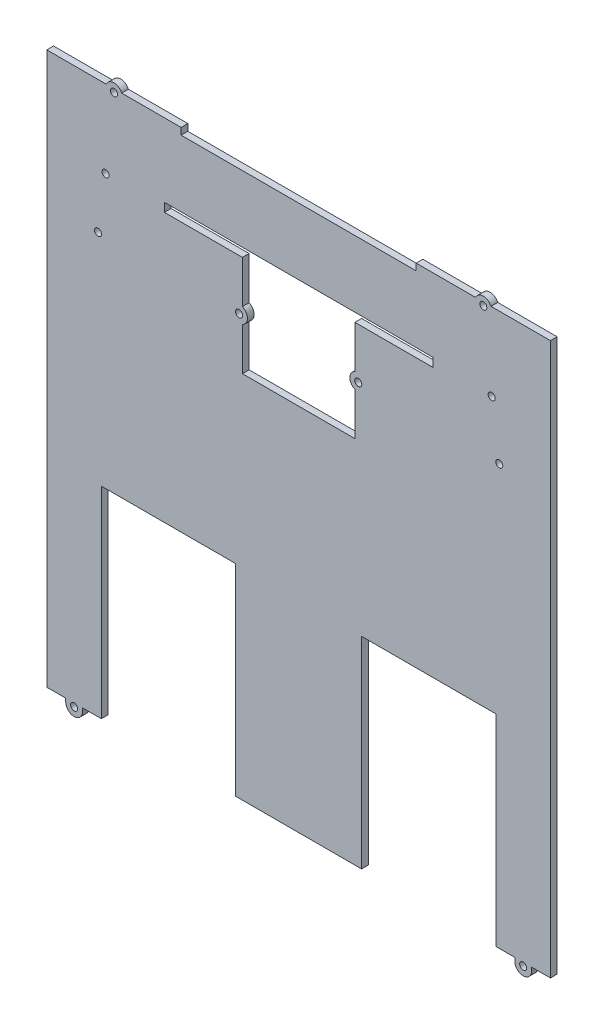
from build123d import *
from build123d.topology import SkipClean

# Parameters (mm, degrees)
ESQUISSE1_W             = 300
ESQUISSE1_H             = 280
BOSS_EXTRU_1_DEPTH      = 4
ESQUISSE2_W             = 80
ESQUISSE2_H             = 120
ENL_V_MAT_EXTRU_1_DEPTH = 206.221831197
ESQUISSE4_W             = 67
ESQUISSE4_H             = 60
ENL_V_MAT_EXTRU_3_DEPTH = 206.221831197
BOSS_EXTRU_2_DEPTH      = 4
ESQUISSE6_R             = 2.1
ENL_V_MAT_EXTRU_4_DEPTH = 211.059515376
BOSS_EXTRU_3_DEPTH      = 4
BOSS_EXTRU_4_DEPTH      = 4
ESQUISSE9_R             = 2.1
ENL_V_MAT_EXTRU_5_DEPTH = 244.522565689
ESQUISSE10_R            = 2.1
ENL_V_MAT_EXTRU_6_DEPTH = 244.522565689
ESQUISSE11_R            = 2.1
ENL_V_MAT_EXTRU_7_DEPTH = 244.522565689
BOSS_EXTRU_5_START      = -4
ESQUISSE12_R            = 5
ESQUISSE12_R_2          = 2.1
BOSS_EXTRU_5_DEPTH      = 4


with BuildPart() as part:
    # Esquisse1 → Boss.-Extru.1 (new body)
    with BuildSketch(Plane.XY):
        Rectangle(ESQUISSE1_W, ESQUISSE1_H)
    extrude(amount=BOSS_EXTRU_1_DEPTH)

    # Esquisse2 → Enlèv. mat.-Extru.1 (cut, through all)
    with BuildSketch(Plane.XY.offset(4)):
        with Locations((77.5, -80)):
            Rectangle(ESQUISSE2_W, ESQUISSE2_H)
        with Locations((-77.5, -80)):
            Rectangle(ESQUISSE2_W, ESQUISSE2_H)
    extrude(amount=-ENL_V_MAT_EXTRU_1_DEPTH, mode=Mode.SUBTRACT)

    # Esquisse4 → Enlèv. mat.-Extru.3 (cut, through all)
    with BuildSketch(Plane(origin=(0, 0, 0), x_dir=(-1, 0, 0), z_dir=(0, 0, -1))):
        with Locations((0, 110)):
            Rectangle(ESQUISSE4_W, ESQUISSE4_H)
    extrude(amount=-ENL_V_MAT_EXTRU_3_DEPTH, mode=Mode.SUBTRACT)

    # Esquisse5 → Boss.-Extru.2 (add)
    with BuildSketch(Plane(origin=(0, 0, 0), x_dir=(-1, 0, 0), z_dir=(0, 0, -1))):
        with BuildLine():
            Line((-128.75, -142), (-128.75, -140))
            Line((-128.75, -140), (-138.75, -140))
            Line((-138.75, -140), (-138.75, -142))
            ThreePointArc((-138.75, -142), (-133.75, -147), (-128.75, -142))
        make_face()
        with BuildLine():
            Line((138.75, -140), (128.75, -140))
            Line((128.75, -140), (128.75, -142))
            ThreePointArc((128.75, -142), (133.75, -147), (138.75, -142))
            Line((138.75, -142), (138.75, -140))
        make_face()
    extrude(amount=-BOSS_EXTRU_2_DEPTH)

    # Esquisse6 → Enlèv. mat.-Extru.4 (cut, through all)
    with BuildSketch(Plane(origin=(0, 0, 0), x_dir=(-1, 0, 0), z_dir=(0, 0, -1))):
        with Locations((-133.75, -142)):
            Circle(ESQUISSE6_R)
        with Locations((133.75, -142)):
            Circle(ESQUISSE6_R)
    extrude(amount=-ENL_V_MAT_EXTRU_4_DEPTH, mode=Mode.SUBTRACT)

    # Esquisse7 → Boss.-Extru.3 (add)
    with BuildSketch(Plane(origin=(0, 0, 0), x_dir=(-1, 0, 0), z_dir=(0, 0, -1))):
        Polygon((-150, 140), (-150, 184.8), (150, 184.8), (150, 140), (80, 140), (80, 145.2), (-80, 145.2), (-80, 140), align=None)
    extrude(amount=-BOSS_EXTRU_3_DEPTH)

    # Esquisse8 → Boss.-Extru.4 (add)
    with BuildSketch(Plane(origin=(0, 0, 0), x_dir=(-1, 0, 0), z_dir=(0, 0, -1))):
        with BuildLine():
            Line((-150, 184.8), (-150, 188.8))
            Line((-150, 188.8), (-114.582575695, 188.8))
            ThreePointArc((-114.582575695, 188.8), (-110, 191.8), (-105.417424305, 188.8))
            Line((-105.417424305, 188.8), (-70, 188.8))
            Line((-70, 188.8), (-70, 184.8))
            Line((-70, 184.8), (-150, 184.8))
        make_face()
        with BuildLine():
            Line((105.417424305, 188.8), (70, 188.8))
            Line((70, 188.8), (70, 184.8))
            Line((70, 184.8), (150, 184.8))
            Line((150, 184.8), (150, 188.8))
            Line((150, 188.8), (114.582575695, 188.8))
            ThreePointArc((114.582575695, 188.8), (110, 191.8), (105.417424305, 188.8))
        make_face()
    extrude(amount=-BOSS_EXTRU_4_DEPTH)

    # Esquisse9 → Enlèv. mat.-Extru.5 (cut, through all)
    with BuildSketch(Plane(origin=(0, 0, 0), x_dir=(-1, 0, 0), z_dir=(0, 0, -1))):
        with Locations((-110, 186.8)):
            Circle(ESQUISSE9_R)
        with Locations((110, 186.8)):
            Circle(ESQUISSE9_R)
    extrude(amount=-ENL_V_MAT_EXTRU_5_DEPTH, mode=Mode.SUBTRACT)

    # Esquisse10 → Enlèv. mat.-Extru.6 (cut, through all)
    with BuildSketch(Plane(origin=(0, 0, 0), x_dir=(-1, 0, 0), z_dir=(0, 0, -1))):
        with Locations((115, 142.5)):
            Circle(ESQUISSE10_R)
        with Locations((-115, 142.5)):
            Circle(ESQUISSE10_R)
    extrude(amount=-ENL_V_MAT_EXTRU_6_DEPTH, mode=Mode.SUBTRACT)

    # Esquisse11 → Enlèv. mat.-Extru.7 (cut, through all)
    with BuildSketch(Plane.XY.offset(4)):
        with Locations((35.5, 110)):
            Circle(ESQUISSE11_R)
        with Locations((119.5, 110)):
            Circle(ESQUISSE11_R)
        with Locations((-119.5, 110)):
            Circle(ESQUISSE11_R)
        with Locations((-35.5, 110)):
            Circle(ESQUISSE11_R)
    extrude(amount=-ENL_V_MAT_EXTRU_7_DEPTH, mode=Mode.SUBTRACT)

    # Esquisse12 → Boss.-Extru.5 (add)
    # profile 1 of 2: a face of its own
    with SkipClean():  # the faces are left unmerged after this step: merging them gives an invalid solid
        with BuildSketch(Plane(origin=(0, 0, 0), x_dir=(-1, 0, 0), z_dir=(0, 0, -1)).offset(BOSS_EXTRU_5_START)):
            with Locations((-35.5, 110)):
                Circle(ESQUISSE12_R)
            with Locations((-35.5, 110)):
                Circle(ESQUISSE12_R_2, mode=Mode.SUBTRACT)
        # profile 2 of 2: a face of its own
        with BuildSketch(Plane(origin=(0, 0, 0), x_dir=(-1, 0, 0), z_dir=(0, 0, -1)).offset(BOSS_EXTRU_5_START)):
            with Locations((35.5, 110)):
                Circle(ESQUISSE12_R)
            with Locations((35.5, 110)):
                Circle(ESQUISSE12_R_2, mode=Mode.SUBTRACT)
        extrude(amount=BOSS_EXTRU_5_DEPTH)
    add(part.part.scale(1), mode=Mode.REPLACE)  # the faces are merged on a copy


solid = part.part
